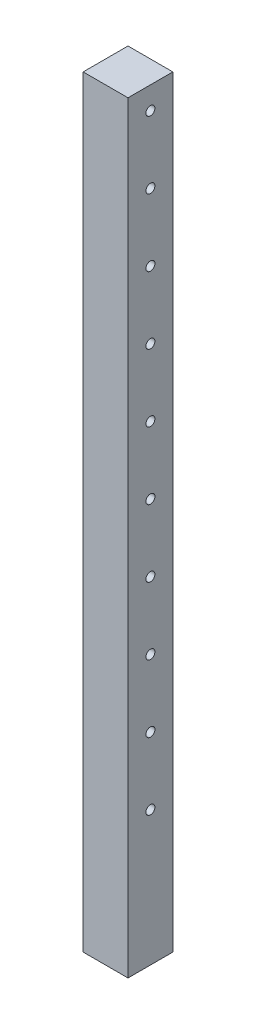
from build123d import *

# Parameters (mm, degrees)
ESBO_O1_W                = 100
ESBO_O1_H                = 100
RESSALTO_EXTRUS_O1_DEPTH = 1700
ESBO_O2_R                = 10
CORTE_EXTRUS_O1_DEPTH    = 1704.67250374


with BuildPart() as part:
    # Esboço1 → Ressalto-extrusão1 (new body)
    with BuildSketch(Plane(origin=(0, 0, 0), x_dir=(1, 0, 0), z_dir=(0, 1, 0))):
        Rectangle(ESBO_O1_W, ESBO_O1_H)
    extrude(amount=RESSALTO_EXTRUS_O1_DEPTH)

    # Esboço2 → Corte-extrusão1 (cut, through all)
    with BuildSketch(Plane.ZY.offset(50)):
        with Locations((0, 1650)):
            Circle(ESBO_O2_R)
        with Locations((0, 1500)):
            Circle(ESBO_O2_R)
        with Locations((0, 1350)):
            Circle(ESBO_O2_R)
        with Locations((0, 1200)):
            Circle(ESBO_O2_R)
        with Locations((0, 1050)):
            Circle(ESBO_O2_R)
        with Locations((0, 900)):
            Circle(ESBO_O2_R)
        with Locations((0, 750)):
            Circle(ESBO_O2_R)
        with Locations((0, 600)):
            Circle(ESBO_O2_R)
        with Locations((0, 450)):
            Circle(ESBO_O2_R)
        with Locations((0, 300)):
            Circle(ESBO_O2_R)
    extrude(amount=-CORTE_EXTRUS_O1_DEPTH, mode=Mode.SUBTRACT)


solid = part.part
